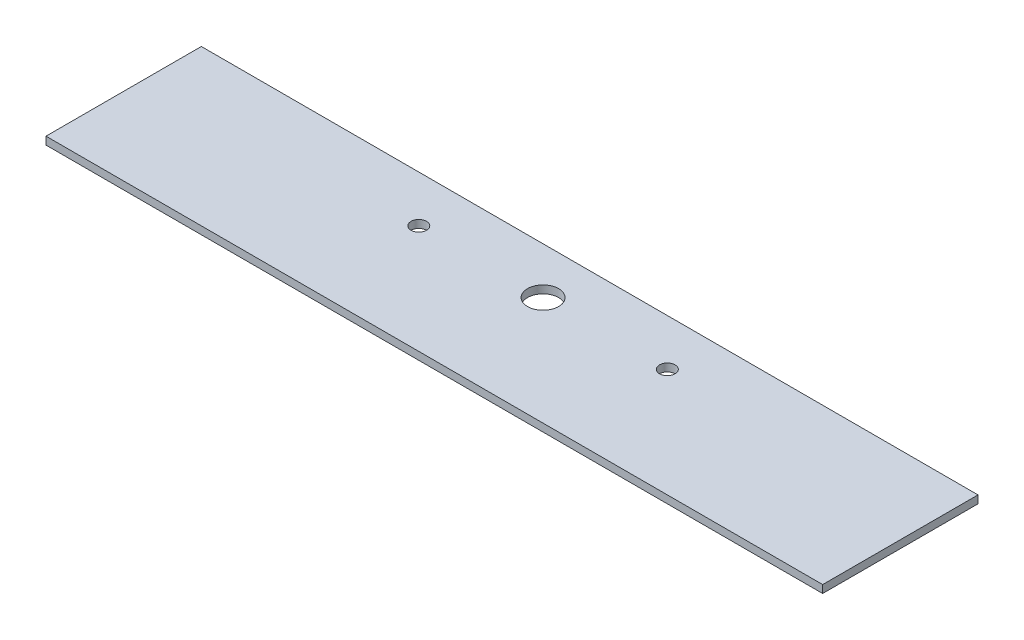
from build123d import *

# Parameters (mm, degrees)
SKETCH1_W           = 500
SKETCH1_H           = 100
BOSS_EXTRUDE1_DEPTH = 5
SKETCH3_R           = 10
CUT_EXTRUDE1_DEPTH  = 510.926465287
SKETCH4_R           = 5
CUT_EXTRUDE2_DEPTH  = 510.926465287
SKETCH5_R           = 5
CUT_EXTRUDE3_DEPTH  = 510.926465287


with BuildPart() as part:
    # Sketch1 → Boss-Extrude1 (new body)
    with BuildSketch(Plane(origin=(0, 0, 0), x_dir=(1, 0, 0), z_dir=(0, 1, 0))):
        with Locations((250, 50)):
            Rectangle(SKETCH1_W, SKETCH1_H)
    extrude(amount=BOSS_EXTRUDE1_DEPTH)

    # Sketch3 → Cut-Extrude1 (cut, through all)
    with BuildSketch(Plane(origin=(0, 5, 0), x_dir=(1, 0, 0), z_dir=(0, 1, 0))):
        with Locations((250, 70)):
            Circle(SKETCH3_R)
    extrude(amount=-CUT_EXTRUDE1_DEPTH, mode=Mode.SUBTRACT)

    # Sketch4 → Cut-Extrude2 (cut, through all)
    with BuildSketch(Plane(origin=(0, 5, 0), x_dir=(1, 0, 0), z_dir=(0, 1, 0))):
        with Locations((170, 70)):
            Circle(SKETCH4_R)
    extrude(amount=-CUT_EXTRUDE2_DEPTH, mode=Mode.SUBTRACT)

    # Sketch5 → Cut-Extrude3 (cut, through all)
    with BuildSketch(Plane(origin=(0, 5, 0), x_dir=(1, 0, 0), z_dir=(0, 1, 0))):
        with Locations((330, 70)):
            Circle(SKETCH5_R)
    extrude(amount=-CUT_EXTRUDE3_DEPTH, mode=Mode.SUBTRACT)


solid = part.part
